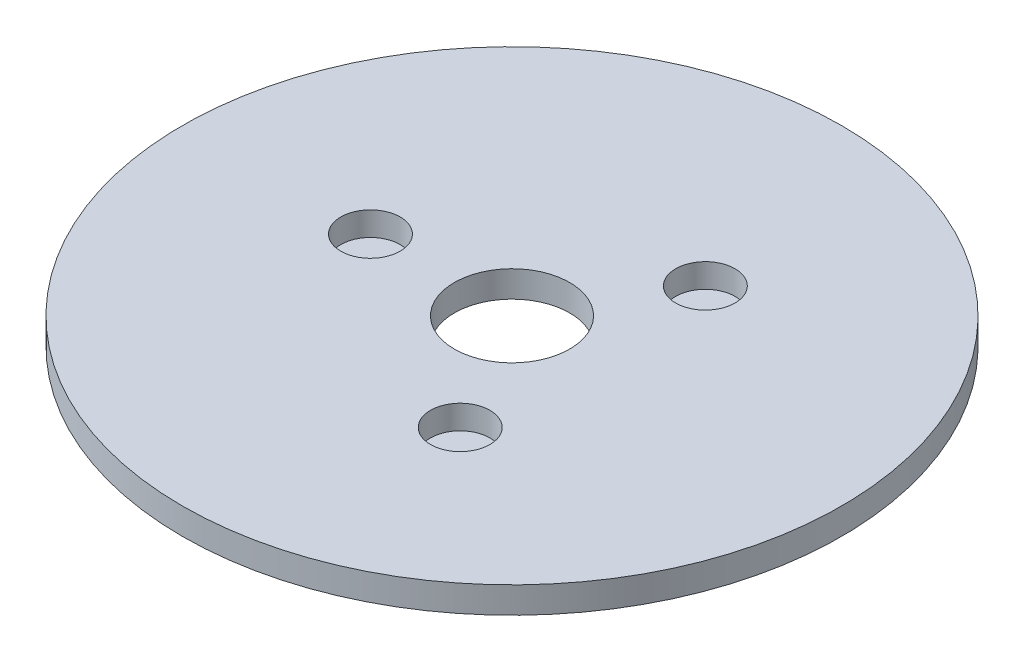
from build123d import *

# Parameters (mm, degrees)
SKETCH1_R           = 100
BOSS_EXTRUDE1_DEPTH = 8
SKETCH2_R           = 17.5
CUT_EXTRUDE1_DEPTH  = 142.647449677
SKETCH3_R           = 9.009876889
CUT_EXTRUDE2_DEPTH  = 7.269340773
CIRPATTERN1_COUNT   = 3


with BuildPart() as part:
    # Sketch1 → Boss-Extrude1 (new body)
    with BuildSketch(Plane(origin=(0, 0, 0), x_dir=(1, 0, 0), z_dir=(0, 1, 0))):
        Circle(SKETCH1_R)
    extrude(amount=BOSS_EXTRUDE1_DEPTH)

    # Sketch2 → Cut-Extrude1 (cut, through all)
    with BuildSketch(Plane(origin=(0, 0, 0), x_dir=(1, 0, 0), z_dir=(0, 1, 0))):
        Circle(SKETCH2_R)
    extrude(amount=CUT_EXTRUDE1_DEPTH, mode=Mode.SUBTRACT)

    # Sketch3 → Cut-Extrude2 (cut)
    with BuildSketch(Plane(origin=(0, 8, 0), x_dir=(1, 0, 0), z_dir=(0, 1, 0))):
        with Locations((-42.948020952, 0)):
            Circle(SKETCH3_R)
    cut_extrude2 = extrude(amount=-CUT_EXTRUDE2_DEPTH, mode=Mode.SUBTRACT)

    # CirPattern1: Cut-Extrude2 ×3 about axis
    cirpattern1_axis = Axis((0, 0, 0), (0, 1, 0))
    for i in range(1, CIRPATTERN1_COUNT):
        add(cut_extrude2.rotate(cirpattern1_axis, i * 360 / CIRPATTERN1_COUNT), mode=Mode.SUBTRACT)


solid = part.part
